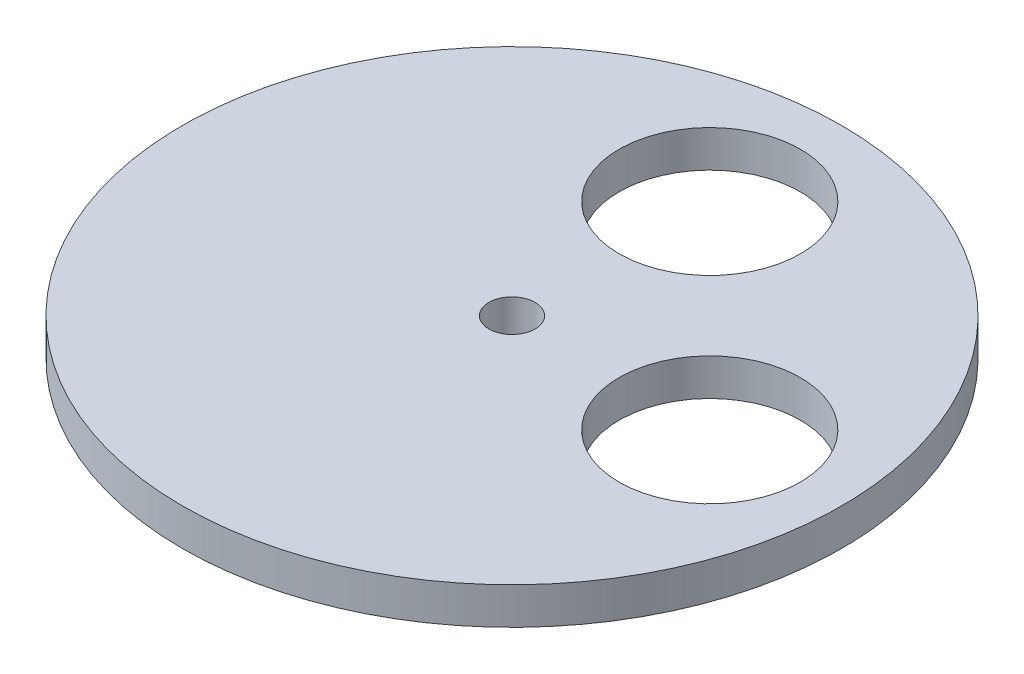
from build123d import *

# Parameters (mm, degrees)
SKETCH6_R           = 63.5
BOSS_EXTRUDE3_DEPTH = 7.112
SKETCH11_R          = 17.4625
CUT_EXTRUDE2_DEPTH  = 180.745877683
SKETCH12_R          = 4.445
CUT_EXTRUDE3_DEPTH  = 180.745877683


with BuildPart() as part:
    # Sketch6 → Boss-Extrude3 (new body)
    with BuildSketch(Plane(origin=(0, 0, 0), x_dir=(1, 0, 0), z_dir=(0, 1, 0))):
        with Locations((63.5, 63.5)):
            Circle(SKETCH6_R)
    extrude(amount=BOSS_EXTRUDE3_DEPTH)

    # Sketch11 → Cut-Extrude2 (cut, through all)
    with BuildSketch(Plane(origin=(0, 7.112, 0), x_dir=(1, 0, 0), z_dir=(0, 1, 0))):
        with Locations((63.5, 101.606632484)):
            Circle(SKETCH11_R)
        with Locations((101.6, 63.5)):
            Circle(SKETCH11_R)
    extrude(amount=-CUT_EXTRUDE2_DEPTH, mode=Mode.SUBTRACT)

    # Sketch12 → Cut-Extrude3 (cut, through all)
    with BuildSketch(Plane(origin=(0, 7.112, 0), x_dir=(1, 0, 0), z_dir=(0, 1, 0))):
        with Locations((63.5, 63.5)):
            Circle(SKETCH12_R)
    extrude(amount=-CUT_EXTRUDE3_DEPTH, mode=Mode.SUBTRACT)


solid = part.part
